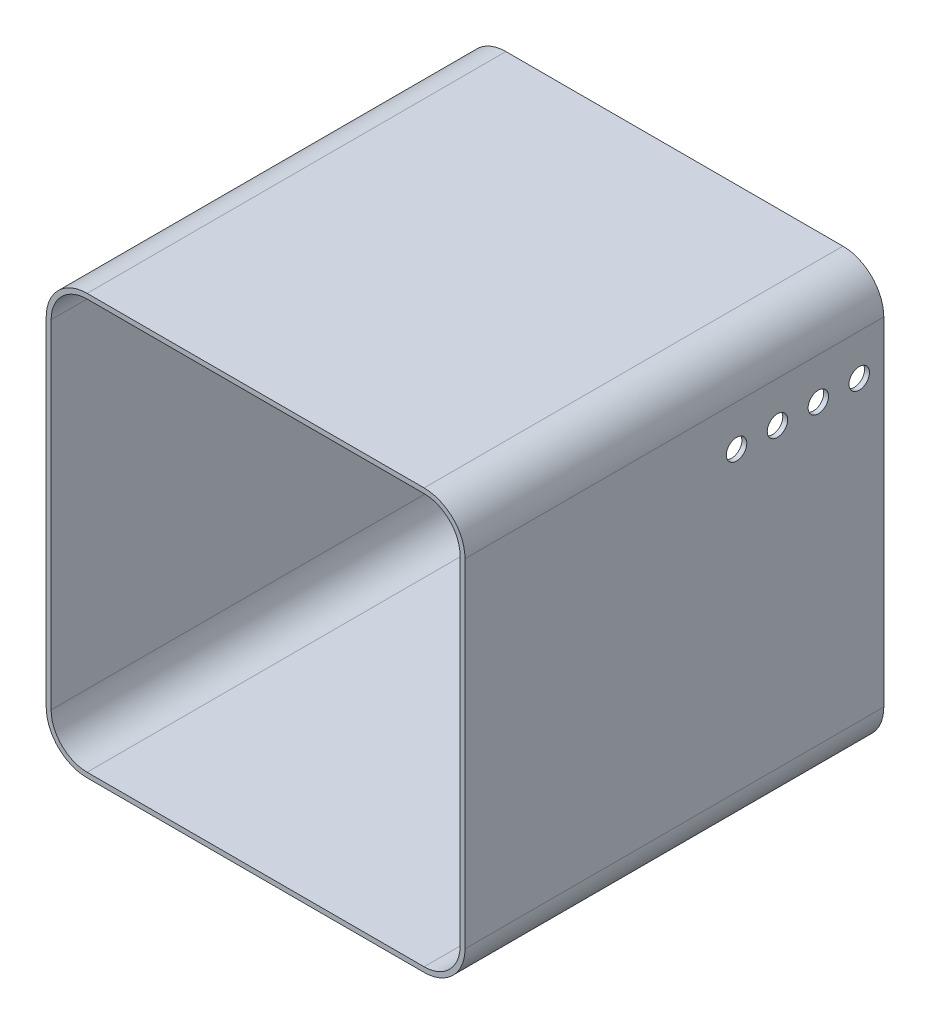
from build123d import *

# Parameters (mm, degrees)
EXTRUDE_THIN1_DEPTH = 512
SKETCH3_R           = 12.5
CUT_EXTRUDE1_DEPTH  = 10
LPATTERN1_COUNT     = 4
LPATTERN1_PITCH     = 50


with BuildPart() as part:
    # Sketch1 → Extrude-Thin1 (new body)
    with BuildSketch(Plane.XY):
        with BuildLine():
            Line((44, -6), (456, -6))
            ThreePointArc((456, -6), (491.355339059, 8.644660941), (506, 44))
            Line((506, 44), (506, 457))
            ThreePointArc((506, 457), (491.355339059, 492.355339059), (456, 507))
            Line((456, 507), (44, 507))
            ThreePointArc((44, 507), (8.644660941, 492.355339059), (-6, 457))
            Line((-6, 457), (-6, 44))
            ThreePointArc((-6, 44), (8.644660941, 8.644660941), (44, -6))
        make_face()
        with BuildLine():
            Line((44, 0), (456, 0))
            ThreePointArc((456, 0), (487.112698372, 12.887301628), (500, 44))
            Line((500, 44), (500, 457))
            ThreePointArc((500, 457), (487.112698372, 488.112698372), (456, 501))
            Line((456, 501), (44, 501))
            ThreePointArc((44, 501), (12.887301628, 488.112698372), (0, 457))
            Line((0, 457), (0, 44))
            ThreePointArc((0, 44), (12.887301628, 12.887301628), (44, 0))
        make_face(mode=Mode.SUBTRACT)
    extrude(amount=-EXTRUDE_THIN1_DEPTH)

    # Sketch3 → Cut-Extrude1 (cut)
    with BuildSketch(Plane(origin=(506, 0, 0), x_dir=(0, 0, -1), z_dir=(1, 0, 0))):
        with Locations((482, 407)):
            Circle(SKETCH3_R)
    cut_extrude1 = extrude(amount=-CUT_EXTRUDE1_DEPTH, mode=Mode.SUBTRACT)

    # LPattern1: Cut-Extrude1 ×4
    with Locations(*[(0, 0, i * LPATTERN1_PITCH) for i in range(1, LPATTERN1_COUNT)]):
        add(cut_extrude1, mode=Mode.SUBTRACT)


solid = part.part
